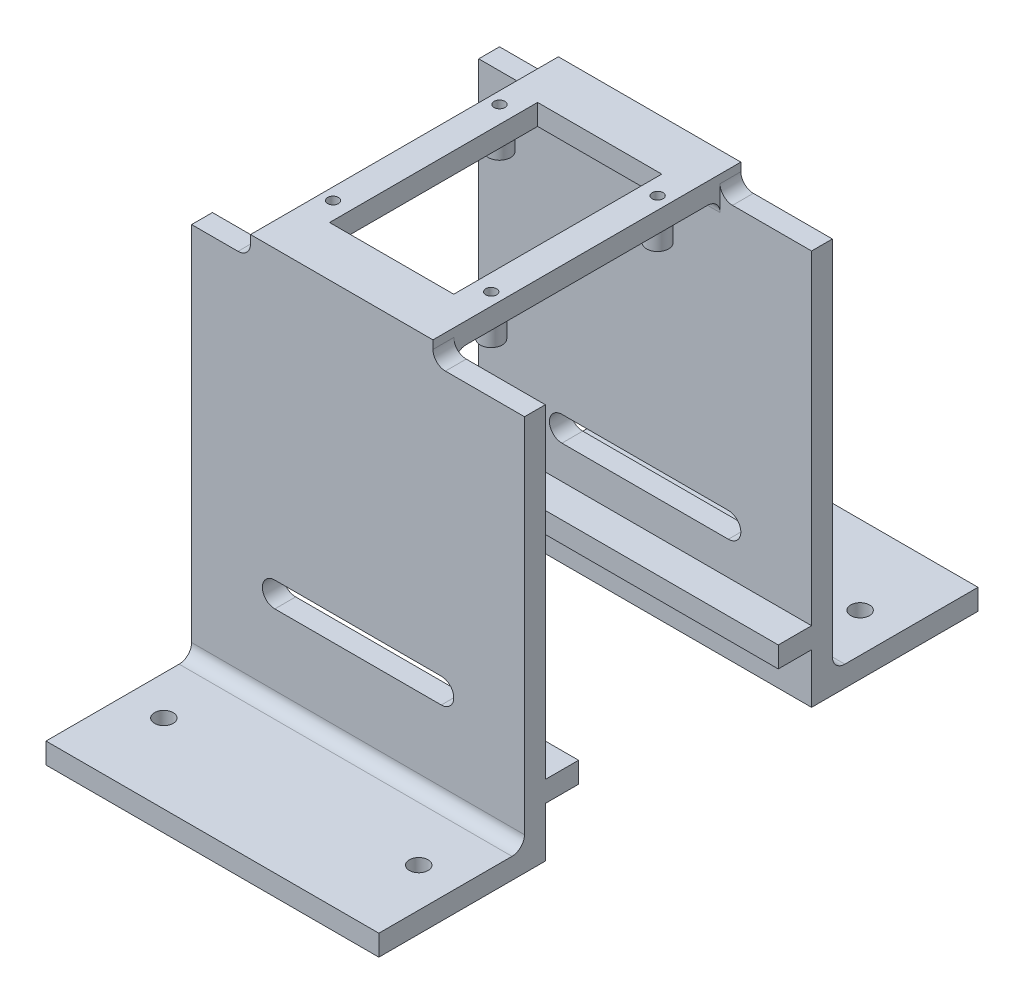
from build123d import *

# Parameters (mm, degrees)
SKETCH1_W             = 80
SKETCH1_H             = 40
SKETCH1_R             = 2.25
BOSS_EXTRUDE1_DEPTH   = 5
BOSS_EXTRUDE1_2_DEPTH = 5
SKETCH2_W             = 80
SKETCH2_H             = 5
BOSS_EXTRUDE2_DEPTH   = 90
SKETCH3_W             = 43.85
SKETCH3_H             = 74
BOSS_EXTRUDE3_DEPTH   = 5
SKETCH5_W             = 29.85
SKETCH5_H             = 50
CUT_EXTRUDE2_DEPTH    = 10
CUT_EXTRUDE1_REACH    = 131.553
SKETCH4_R             = 1.3
FILLET1_R             = 3
FILLET2_R             = 3
SKETCH9_R             = 2.65
SKETCH9_R_2           = 1.05
BOSS_EXTRUDE5_DEPTH   = 4.75
SKETCH10_W            = 12
SKETCH10_H            = 6.8
CUT_EXTRUDE4_DEPTH    = 8
SKETCH11_W            = 80
SKETCH11_H            = 5
BOSS_EXTRUDE6_DEPTH   = 8
CUT_EXTRUDE5_REACH    = 155.235


with BuildPart() as part:
    # Sketch1 → Boss-Extrude1 (new body)
    with BuildSketch(Plane(origin=(0, 0, 0), x_dir=(1, 0, 0), z_dir=(0, 1, 0))):
        with Locations((0, 52)):
            Rectangle(SKETCH1_W, SKETCH1_H)
        with Locations((-30.625, 53.044055982)):
            Circle(SKETCH1_R, mode=Mode.SUBTRACT)
        with Locations((30.625, 53.044055982)):
            Circle(SKETCH1_R, mode=Mode.SUBTRACT)
    extrude(amount=BOSS_EXTRUDE1_DEPTH)



with BuildPart() as body_2:
    # Sketch1 → Boss-Extrude1 2 (new body)
    with BuildSketch(Plane(origin=(0, 0, 0), x_dir=(1, 0, 0), z_dir=(0, 1, 0))):
        with Locations((0, -52)):
            Rectangle(SKETCH1_W, SKETCH1_H)
        with Locations((30.625, -53.044055982)):
            Circle(SKETCH1_R, mode=Mode.SUBTRACT)
        with Locations((-30.625, -53.044055982)):
            Circle(SKETCH1_R, mode=Mode.SUBTRACT)
    extrude(amount=BOSS_EXTRUDE1_2_DEPTH)


with BuildPart() as part_1:
    add(part.part)

    add(body_2.part)  # Boss-Extrude2 merges body 2
    # Sketch2 → Boss-Extrude2 (add)
    with BuildSketch(Plane(origin=(0, 5, 0), x_dir=(1, 0, 0), z_dir=(0, 1, 0))):
        with Locations((0, 34.5)):
            Rectangle(SKETCH2_W, SKETCH2_H)
        with Locations((0, -34.5)):
            Rectangle(SKETCH2_W, SKETCH2_H)
    extrude(amount=BOSS_EXTRUDE2_DEPTH)

    # Sketch3 → Boss-Extrude3 (add)
    with BuildSketch(Plane(origin=(0, 95, 0), x_dir=(1, 0, 0), z_dir=(0, 1, 0))):
        with Locations((-3.925, 0)):
            Rectangle(SKETCH3_W, SKETCH3_H)
    extrude(amount=BOSS_EXTRUDE3_DEPTH)

    # Sketch5 → Cut-Extrude2 (cut)
    with BuildSketch(Plane.XZ.offset(-95)):
        with Locations((-3.925, 0)):
            Rectangle(SKETCH5_W, SKETCH5_H)
    extrude(amount=-CUT_EXTRUDE2_DEPTH, mode=Mode.SUBTRACT)

    # Sketch4 → Cut-Extrude1 (cut, up to next)
    with BuildSketch(Plane(origin=(0, 100, 0), x_dir=(1, 0, 0), z_dir=(0, 1, 0)), mode=Mode.PRIVATE) as cut_extrude1_sk1:
        with Locations((-23, 20)):
            Circle(SKETCH4_R)
    cut_extrude1_tool1 = extrude(cut_extrude1_sk1.sketch, amount=-CUT_EXTRUDE1_REACH, mode=Mode.PRIVATE) & part_1.part
    # Sketch4 → Cut-Extrude1 (cut, up to next)
    with BuildSketch(Plane(origin=(0, 100, 0), x_dir=(1, 0, 0), z_dir=(0, 1, 0)), mode=Mode.PRIVATE) as cut_extrude1_sk2:
        with Locations((15, 20)):
            Circle(SKETCH4_R)
    cut_extrude1_tool2 = extrude(cut_extrude1_sk2.sketch, amount=-CUT_EXTRUDE1_REACH, mode=Mode.PRIVATE) & part_1.part
    # Sketch4 → Cut-Extrude1 (cut, up to next)
    with BuildSketch(Plane(origin=(0, 100, 0), x_dir=(1, 0, 0), z_dir=(0, 1, 0)), mode=Mode.PRIVATE) as cut_extrude1_sk3:
        with Locations((15, -20)):
            Circle(SKETCH4_R)
    cut_extrude1_tool3 = extrude(cut_extrude1_sk3.sketch, amount=-CUT_EXTRUDE1_REACH, mode=Mode.PRIVATE) & part_1.part
    # Sketch4 → Cut-Extrude1 (cut, up to next)
    with BuildSketch(Plane(origin=(0, 100, 0), x_dir=(1, 0, 0), z_dir=(0, 1, 0)), mode=Mode.PRIVATE) as cut_extrude1_sk4:
        with Locations((-23, -20)):
            Circle(SKETCH4_R)
    cut_extrude1_tool4 = extrude(cut_extrude1_sk4.sketch, amount=-CUT_EXTRUDE1_REACH, mode=Mode.PRIVATE) & part_1.part
    add(cut_extrude1_tool1.solids().sort_by_distance((-23, 100, -20))[0], mode=Mode.SUBTRACT)
    add(cut_extrude1_tool2.solids().sort_by_distance((15, 100, -20))[0], mode=Mode.SUBTRACT)
    add(cut_extrude1_tool3.solids().sort_by_distance((15, 100, 20))[0], mode=Mode.SUBTRACT)
    add(cut_extrude1_tool4.solids().sort_by_distance((-23, 100, 20))[0], mode=Mode.SUBTRACT)

    # Fillet1
    fillet1_edges = [part_1.edges().sort_by_distance(p)[0] for p in [
        (-3.925, 95, -32),
        (-3.925, 95, 32),
        (0, 5, -37),
        (0, 5, 37),
    ]]
    fillet(fillet1_edges, radius=FILLET1_R)

    # Fillet2
    fillet2_edges = [part_1.edges().sort_by_distance(p)[0] for p in [
        (18, 95, -34.5),
        (-25.85, 95, -34.5),
        (-25.85, 95, 34.5),
        (18, 95, 34.5),
    ]]
    fillet(fillet2_edges, radius=FILLET2_R)

    # Sketch9 → Boss-Extrude5 (add)
    # profile 1 of 4: a face of its own
    with BuildSketch(Plane.XZ.offset(-95)):
        with Locations((-23, 20)):
            Circle(SKETCH9_R)
        with Locations((-23, 20)):
            Circle(SKETCH9_R_2, mode=Mode.SUBTRACT)
    # profile 2 of 4: a face of its own
    with BuildSketch(Plane.XZ.offset(-95)):
        with Locations((-23, -20)):
            Circle(SKETCH9_R)
        with Locations((-23, -20)):
            Circle(SKETCH9_R_2, mode=Mode.SUBTRACT)
    # profile 3 of 4: a face of its own
    with BuildSketch(Plane.XZ.offset(-95)):
        with Locations((15, 20)):
            Circle(SKETCH9_R)
        with Locations((15, 20)):
            Circle(SKETCH9_R_2, mode=Mode.SUBTRACT)
    # profile 4 of 4: a face of its own
    with BuildSketch(Plane.XZ.offset(-95)):
        with Locations((15, -20)):
            Circle(SKETCH9_R)
        with Locations((15, -20)):
            Circle(SKETCH9_R_2, mode=Mode.SUBTRACT)
    extrude(amount=BOSS_EXTRUDE5_DEPTH)

    # Sketch10 → Cut-Extrude4 (cut)
    with BuildSketch(Plane.XY.offset(37)):
        with Locations((6.7, 92.15)):
            Rectangle(SKETCH10_W, SKETCH10_H)
    extrude(amount=-CUT_EXTRUDE4_DEPTH, mode=Mode.SUBTRACT)

    # Sketch11 → Boss-Extrude6 (add)
    with BuildSketch(Plane(origin=(0, 0, 32), x_dir=(-1, 0, 0), z_dir=(0, 0, -1))):
        with Locations((0, 14.5)):
            Rectangle(SKETCH11_W, SKETCH11_H)
    extrude(amount=BOSS_EXTRUDE6_DEPTH)

    # Mirror3: part across plane


with BuildPart() as part_2:
    add(part_1.part)
    add(part_1.part.mirror(Plane.XY))

    # Sketch12 → Cut-Extrude5 (cut, up to next)
    with BuildSketch(Plane(origin=(0, 0, -37), x_dir=(-1, 0, 0), z_dir=(0, 0, -1)), mode=Mode.PRIVATE) as cut_extrude5_sk1:
        with BuildLine():
            Line((20, 25), (-20, 25))
            ThreePointArc((-20, 25), (-23, 28), (-20, 31))
            Line((-20, 31), (20, 31))
            ThreePointArc((20, 31), (23, 28), (20, 25))
        make_face()
    cut_extrude5_tool1 = extrude(cut_extrude5_sk1.sketch, amount=-CUT_EXTRUDE5_REACH, mode=Mode.PRIVATE) & part_2.part
    cut_extrude5 = cut_extrude5_tool1.solids().sort_by_distance((0, 28, -37))[0]
    add(cut_extrude5, mode=Mode.SUBTRACT)

    # Mirror4: Cut-Extrude5 across plane
    add(cut_extrude5.mirror(Plane.XY), mode=Mode.SUBTRACT)


solid = part_2.part
